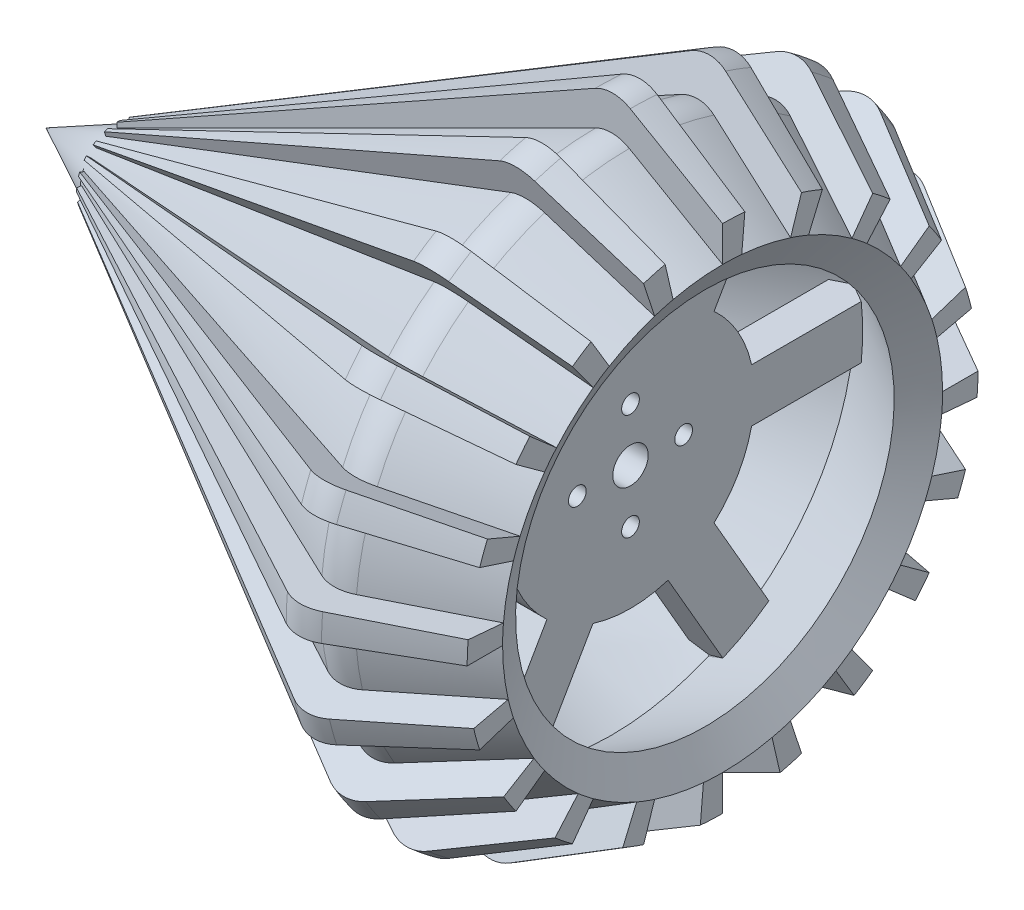
from build123d import *

# Parameters (mm, degrees)
REVOLVE8_ANGLE      = 5
CIRPATTERN3_COUNT   = 20
FILLET2_R           = 12.7
SKETCH4_R           = 6.35
SKETCH4_R_2         = 3.175
BOSS_EXTRUDE1_DEPTH = 6.35
SKETCH5_R           = 6.35
BOSS_EXTRUDE2_DEPTH = 6.35


with BuildPart() as part:
    # Sketch2 → Revolve1 (revolve)
    with BuildSketch(Plane.XY):
        Polygon((39.369890216, 78.869783286), (0, 101.6), (-203.2, 0), (-174.801936686, 0), (-0.432231925, 87.184852381), (33.019890216, 67.871260658), align=None)
    revolve(axis=Axis((33.461450024, 0, 0), (-1, 0, 0)))


with BuildPart() as body_2:
    # Sketch3 → Revolve8 (revolve)
    with BuildSketch(Plane.XY):
        Polygon((-177.8, 14.461868907), (0, 114.3), (39.369890216, 91.569783286), (39.369890216, 78.869783286), (0, 101.6), (-177.8, 12.7), align=None)
    revolve(axis=Axis((95.945299933, 0, 0), (-1, 0, 0)), revolution_arc=REVOLVE8_ANGLE)


with BuildPart() as cirpattern3_1:
    # CirPattern3: pattern copy
    add(body_2.part.rotate(Axis((-279.640332464, 0, 0), (1, 0, 0)), 1 * 360 / CIRPATTERN3_COUNT))


with BuildPart() as cirpattern3_2:
    # CirPattern3: pattern copy
    add(body_2.part.rotate(Axis((-279.640332464, 0, 0), (1, 0, 0)), 2 * 360 / CIRPATTERN3_COUNT))


with BuildPart() as cirpattern3_3:
    # CirPattern3: pattern copy
    add(body_2.part.rotate(Axis((-279.640332464, 0, 0), (1, 0, 0)), 3 * 360 / CIRPATTERN3_COUNT))


with BuildPart() as cirpattern3_4:
    # CirPattern3: pattern copy
    add(body_2.part.rotate(Axis((-279.640332464, 0, 0), (1, 0, 0)), 4 * 360 / CIRPATTERN3_COUNT))


with BuildPart() as cirpattern3_5:
    # CirPattern3: pattern copy
    add(body_2.part.rotate(Axis((-279.640332464, 0, 0), (1, 0, 0)), 5 * 360 / CIRPATTERN3_COUNT))


with BuildPart() as cirpattern3_6:
    # CirPattern3: pattern copy
    add(body_2.part.rotate(Axis((-279.640332464, 0, 0), (1, 0, 0)), 6 * 360 / CIRPATTERN3_COUNT))


with BuildPart() as cirpattern3_7:
    # CirPattern3: pattern copy
    add(body_2.part.rotate(Axis((-279.640332464, 0, 0), (1, 0, 0)), 7 * 360 / CIRPATTERN3_COUNT))


with BuildPart() as cirpattern3_8:
    # CirPattern3: pattern copy
    add(body_2.part.rotate(Axis((-279.640332464, 0, 0), (1, 0, 0)), 8 * 360 / CIRPATTERN3_COUNT))


with BuildPart() as cirpattern3_9:
    # CirPattern3: pattern copy
    add(body_2.part.rotate(Axis((-279.640332464, 0, 0), (1, 0, 0)), 9 * 360 / CIRPATTERN3_COUNT))


with BuildPart() as cirpattern3_10:
    # CirPattern3: pattern copy
    add(body_2.part.rotate(Axis((-279.640332464, 0, 0), (1, 0, 0)), 10 * 360 / CIRPATTERN3_COUNT))


with BuildPart() as cirpattern3_11:
    # CirPattern3: pattern copy
    add(body_2.part.rotate(Axis((-279.640332464, 0, 0), (1, 0, 0)), 11 * 360 / CIRPATTERN3_COUNT))


with BuildPart() as cirpattern3_12:
    # CirPattern3: pattern copy
    add(body_2.part.rotate(Axis((-279.640332464, 0, 0), (1, 0, 0)), 12 * 360 / CIRPATTERN3_COUNT))


with BuildPart() as cirpattern3_13:
    # CirPattern3: pattern copy
    add(body_2.part.rotate(Axis((-279.640332464, 0, 0), (1, 0, 0)), 13 * 360 / CIRPATTERN3_COUNT))


with BuildPart() as cirpattern3_14:
    # CirPattern3: pattern copy
    add(body_2.part.rotate(Axis((-279.640332464, 0, 0), (1, 0, 0)), 14 * 360 / CIRPATTERN3_COUNT))


with BuildPart() as cirpattern3_15:
    # CirPattern3: pattern copy
    add(body_2.part.rotate(Axis((-279.640332464, 0, 0), (1, 0, 0)), 15 * 360 / CIRPATTERN3_COUNT))


with BuildPart() as cirpattern3_16:
    # CirPattern3: pattern copy
    add(body_2.part.rotate(Axis((-279.640332464, 0, 0), (1, 0, 0)), 16 * 360 / CIRPATTERN3_COUNT))


with BuildPart() as cirpattern3_17:
    # CirPattern3: pattern copy
    add(body_2.part.rotate(Axis((-279.640332464, 0, 0), (1, 0, 0)), 17 * 360 / CIRPATTERN3_COUNT))


with BuildPart() as cirpattern3_18:
    # CirPattern3: pattern copy
    add(body_2.part.rotate(Axis((-279.640332464, 0, 0), (1, 0, 0)), 18 * 360 / CIRPATTERN3_COUNT))


with BuildPart() as cirpattern3_19:
    # CirPattern3: pattern copy
    add(body_2.part.rotate(Axis((-279.640332464, 0, 0), (1, 0, 0)), 19 * 360 / CIRPATTERN3_COUNT))

    # Combine1: union body 2, CirPattern3_1, CirPattern3_2, CirPattern3_3, part, CirPattern3_4, CirPattern3_5, CirPattern3_6, CirPattern3_7, CirPattern3_8, CirPattern3_9, CirPattern3_10, CirPattern3_11, CirPattern3_12, CirPattern3_13, CirPattern3_15, CirPattern3_14, CirPattern3_16, CirPattern3_17, CirPattern3_18
    add(body_2.part)
    add(cirpattern3_1.part)
    add(cirpattern3_2.part)
    add(cirpattern3_3.part)
    add(part.part)
    add(cirpattern3_4.part)
    add(cirpattern3_5.part)
    add(cirpattern3_6.part)
    add(cirpattern3_7.part)
    add(cirpattern3_8.part)
    add(cirpattern3_9.part)
    add(cirpattern3_10.part)
    add(cirpattern3_11.part)
    add(cirpattern3_12.part)
    add(cirpattern3_13.part)
    add(cirpattern3_15.part)
    add(cirpattern3_14.part)
    add(cirpattern3_16.part)
    add(cirpattern3_17.part)
    add(cirpattern3_18.part)

    # Fillet2
    fillet2_edges = [cirpattern3_19.edges().sort_by_distance(p)[0] for p in [
        (0, 71.153422968, 89.452112328),
        (0, 50.030233707, 88.428138707),
        (0, 40.028703678, 107.061631231),
        (0, 20.255782137, 99.560349989),
        (0, 4.985695976, 114.191211727),
        (0, -11.501446519, 100.946900537),
        (0, -30.545346386, 110.142960802),
        (0, -42.132833454, 92.452065121),
        (0, -63.086397421, 95.313149462),
        (0, -68.639965094, 74.90737742),
        (0, -89.452112328, 71.153422968),
        (0, -88.428138707, 50.030233707),
        (0, -107.061631231, 40.028703678),
        (0, -99.560349989, 20.255782137),
        (0, -114.191211727, 4.985695976),
        (0, -100.946900537, -11.501446519),
        (0, -110.142960802, -30.545346386),
        (0, -92.452065121, -42.132833454),
        (0, -95.313149462, -63.086397421),
        (0, -74.90737742, -68.639965094),
        (0, -71.153422968, -89.452112328),
        (0, -50.030233707, -88.428138707),
        (0, -40.028703678, -107.061631231),
        (0, -20.255782137, -99.560349989),
        (0, -4.985695976, -114.191211727),
        (0, 11.501446519, -100.946900537),
        (0, 30.545346386, -110.142960802),
        (0, 42.132833454, -92.452065121),
        (0, 63.086397421, -95.313149462),
        (0, 68.639965094, -74.90737742),
        (0, 89.452112328, -71.153422968),
        (0, 88.428138707, -50.030233707),
        (0, 107.061631231, -40.028703678),
        (0, 99.560349989, -20.255782137),
        (0, 100.946900537, 11.501446519),
        (0, 92.452065121, 42.132833454),
        (0, 74.90737742, 68.639965094),
        (0, 95.313149462, 63.086397421),
        (0, 110.142960802, 30.545346386),
        (0, 114.191211727, -4.985695976),
    ]]
    fillet(fillet2_edges, radius=FILLET2_R)

    # Sketch4 → Boss-Extrude1 (add, symmetric)
    with BuildSketch(Plane(origin=(0, 0, 0), x_dir=(0, 0, -1), z_dir=(1, 0, 0))):
        with BuildLine():
            Line((29.957627972, -32.838133721), (55.873891971, -77.72641971))
            Line((55.873891971, -77.72641971), (39.376108029, -87.25141971))
            Line((39.376108029, -87.25141971), (13.45984403, -42.363133721))
            ThreePointArc((13.45984403, -42.363133721), (0, -44.45), (-13.45984403, -42.363133721))
            Line((-13.45984403, -42.363133721), (-39.376108029, -87.25141971))
            Line((-39.376108029, -87.25141971), (-55.873891971, -77.72641971))
            Line((-55.873891971, -77.72641971), (-29.957627972, -32.838133721))
            ThreePointArc((-29.957627972, -32.838133721), (-38.494829198, -22.225), (-43.417472001, -9.525))
            Line((-43.417472001, -9.525), (-95.25, -9.525))
            Line((-95.25, -9.525), (-95.25, 9.525))
            Line((-95.25, 9.525), (-43.417472001, 9.525))
            ThreePointArc((-43.417472001, 9.525), (-38.494829198, 22.225), (-29.957627972, 32.838133721))
            Line((-29.957627972, 32.838133721), (-55.873891971, 77.72641971))
            Line((-55.873891971, 77.72641971), (-39.376108029, 87.25141971))
            Line((-39.376108029, 87.25141971), (-13.45984403, 42.363133721))
            ThreePointArc((-13.45984403, 42.363133721), (0, 44.45), (13.45984403, 42.363133721))
            Line((13.45984403, 42.363133721), (39.376108029, 87.25141971))
            Line((39.376108029, 87.25141971), (55.873891971, 77.72641971))
            Line((55.873891971, 77.72641971), (29.957627972, 32.838133721))
            ThreePointArc((29.957627972, 32.838133721), (38.494829198, 22.225), (43.417472001, 9.525))
            Line((43.417472001, 9.525), (95.25, 9.525))
            Line((95.25, 9.525), (95.25, -9.525))
            Line((95.25, -9.525), (43.417472001, -9.525))
            ThreePointArc((43.417472001, -9.525), (38.494829198, -22.225), (29.957627972, -32.838133721))
        make_face()
        Circle(SKETCH4_R, mode=Mode.SUBTRACT)
        with Locations((0, 19.05)):
            Circle(SKETCH4_R_2, mode=Mode.SUBTRACT)
        with Locations((19.05, 0)):
            Circle(SKETCH4_R_2, mode=Mode.SUBTRACT)
        with Locations((0, -19.05)):
            Circle(SKETCH4_R_2, mode=Mode.SUBTRACT)
        with Locations((-19.05, 0)):
            Circle(SKETCH4_R_2, mode=Mode.SUBTRACT)
    extrude(amount=BOSS_EXTRUDE1_DEPTH, both=True)


with BuildPart() as body_2_2:
    # Sketch5 → Boss-Extrude2 (new, symmetric)
    with BuildSketch(Plane(origin=(-127, 0, 0), x_dir=(0, 0, -1), z_dir=(1, 0, 0))):
        with BuildLine():
            Line((24.593444248, 6.35), (44.45, 6.35))
            Line((44.45, 6.35), (44.45, -6.35))
            Line((44.45, -6.35), (24.593444248, -6.35))
            ThreePointArc((24.593444248, -6.35), (21.997045256, -12.7), (17.795983438, -18.123547486))
            Line((17.795983438, -18.123547486), (27.724261314, -35.319829198))
            Line((27.724261314, -35.319829198), (16.725738686, -41.669829198))
            Line((16.725738686, -41.669829198), (6.79746081, -24.473547486))
            ThreePointArc((6.79746081, -24.473547486), (0, -25.4), (-6.79746081, -24.473547486))
            Line((-6.79746081, -24.473547486), (-16.725738686, -41.669829198))
            Line((-16.725738686, -41.669829198), (-27.724261314, -35.319829198))
            Line((-27.724261314, -35.319829198), (-17.795983438, -18.123547486))
            ThreePointArc((-17.795983438, -18.123547486), (-21.997045256, -12.7), (-24.593444248, -6.35))
            Line((-24.593444248, -6.35), (-44.45, -6.35))
            Line((-44.45, -6.35), (-44.45, 6.35))
            Line((-44.45, 6.35), (-24.593444248, 6.35))
            ThreePointArc((-24.593444248, 6.35), (-21.997045256, 12.7), (-17.795983438, 18.123547486))
            Line((-17.795983438, 18.123547486), (-27.724261314, 35.319829198))
            Line((-27.724261314, 35.319829198), (-16.725738686, 41.669829198))
            Line((-16.725738686, 41.669829198), (-6.79746081, 24.473547486))
            ThreePointArc((-6.79746081, 24.473547486), (0, 25.4), (6.79746081, 24.473547486))
            Line((6.79746081, 24.473547486), (16.725738686, 41.669829198))
            Line((16.725738686, 41.669829198), (27.724261314, 35.319829198))
            Line((27.724261314, 35.319829198), (17.795983438, 18.123547486))
            ThreePointArc((17.795983438, 18.123547486), (21.997045256, 12.7), (24.593444248, 6.35))
        make_face()
        Circle(SKETCH5_R, mode=Mode.SUBTRACT)
    extrude(amount=BOSS_EXTRUDE2_DEPTH, both=True)

    # Sketch6 → Cut-Revolve2 (revolve, cut)
    with BuildSketch(Plane.XY):
        Polygon((-180.028062503, 11.585968749), (-92.052710638, 53.66778179), (-98.551098176, 67.253173883), (-180.028062503, 28.279776138), align=None)
    revolve(axis=Axis((-279.640332464, 0, 0), (1, 0, 0)), mode=Mode.SUBTRACT)


solid = Compound([cirpattern3_19.part, body_2_2.part])
